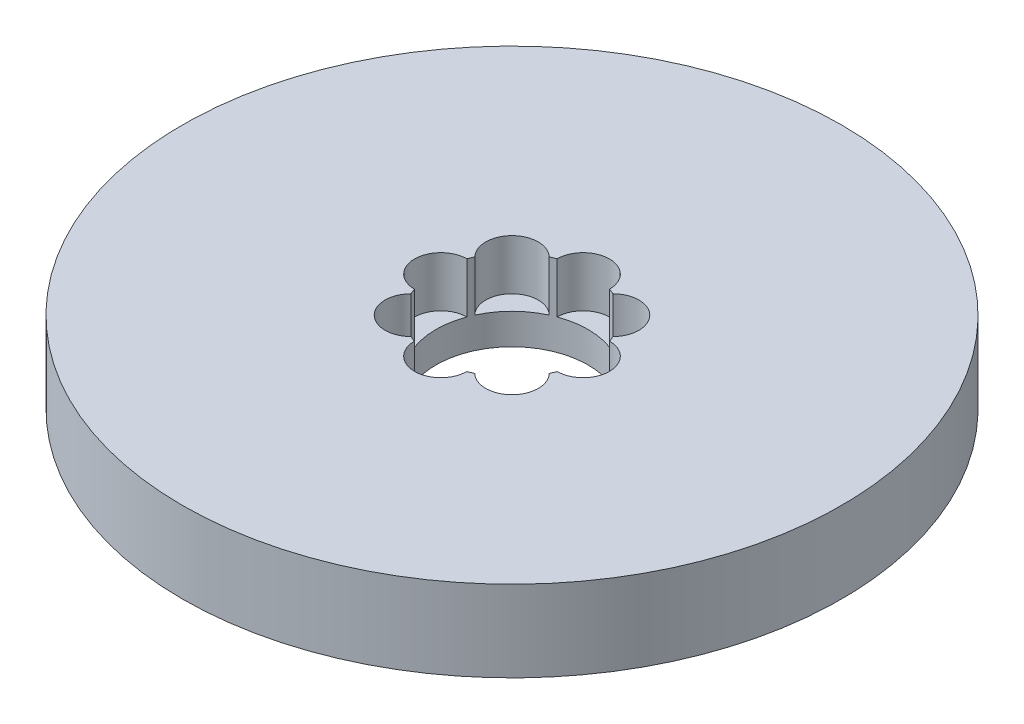
from build123d import *

# Parameters (mm, degrees)
SKETCH1_R           = 65
BOSS_EXTRUDE1_DEPTH = 16
SKETCH2_R           = 15
CUT_EXTRUDE1_DEPTH  = 94.305948363
SKETCH3_R           = 5.179840069
CUT_EXTRUDE2_DEPTH  = 9.935696136
CIRPATTERN1_COUNT   = 8


with BuildPart() as part:
    # Sketch1 → Boss-Extrude1 (new body)
    with BuildSketch(Plane(origin=(0, 0, 0), x_dir=(1, 0, 0), z_dir=(0, 1, 0))):
        Circle(SKETCH1_R)
    extrude(amount=BOSS_EXTRUDE1_DEPTH)

    # Sketch2 → Cut-Extrude1 (cut, through all)
    with BuildSketch(Plane(origin=(0, 0, 0), x_dir=(1, 0, 0), z_dir=(0, 1, 0))):
        Circle(SKETCH2_R)
    extrude(amount=CUT_EXTRUDE1_DEPTH, mode=Mode.SUBTRACT)

    # Sketch3 → Cut-Extrude2 (cut)
    with BuildSketch(Plane(origin=(0, 16, 0), x_dir=(1, 0, 0), z_dir=(0, 1, 0))):
        with Locations((-14.039119556, 0)):
            Circle(SKETCH3_R)
    cut_extrude2 = extrude(amount=-CUT_EXTRUDE2_DEPTH, mode=Mode.SUBTRACT)

    # CirPattern1: Cut-Extrude2 ×8 about axis
    cirpattern1_axis = Axis((0, 0, 0), (0, 1, 0))
    for i in range(1, CIRPATTERN1_COUNT):
        add(cut_extrude2.rotate(cirpattern1_axis, i * 360 / CIRPATTERN1_COUNT), mode=Mode.SUBTRACT)


solid = part.part
